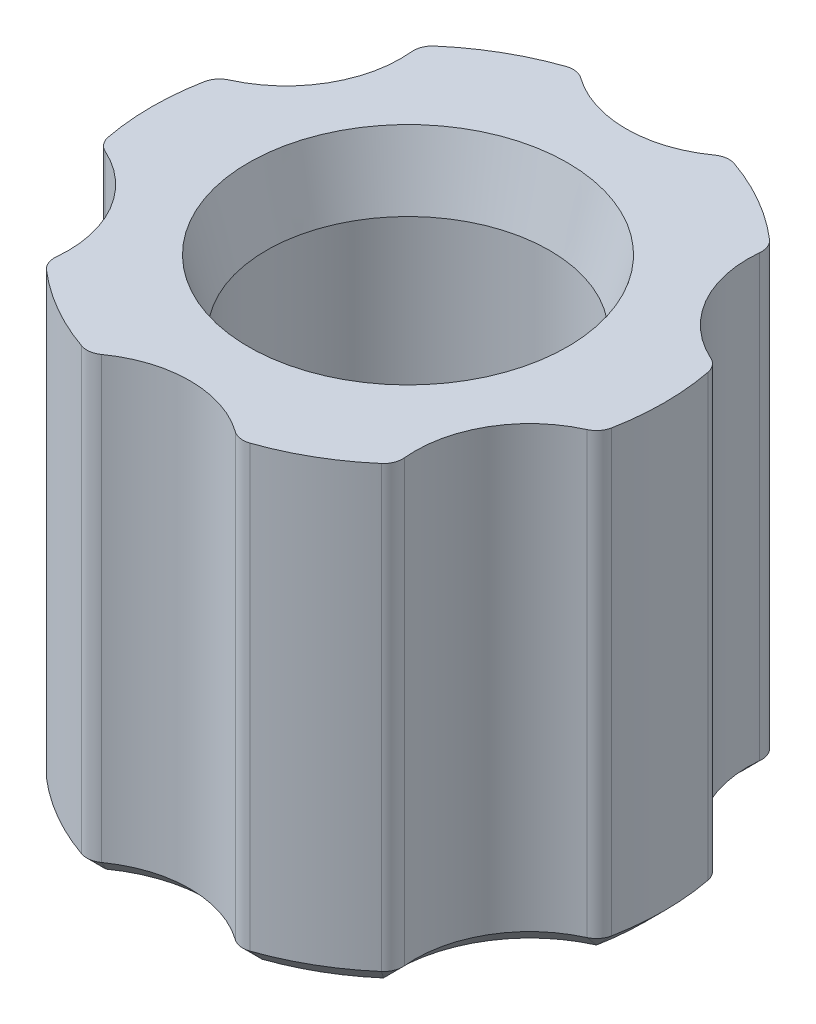
from build123d import *

# Parameters (mm, degrees)
CHAMFER1_SIZE      = 1.75
CHAMFER1_SIZE2     = 0.468911087
SKETCH2_R          = 3
CUT_EXTRUDE1_DEPTH = 16.289865925
CIRPATTERN1_COUNT  = 6
FILLET1_R          = 0.5
CHAMFER2_SIZE      = 0.5


with BuildPart() as part:
    # Sketch1 → Revolve1 (revolve)
    with BuildSketch(Plane(origin=(0, 0, 0), x_dir=(0, 0, -1), z_dir=(1, 0, 0)), mode=Mode.PRIVATE) as revolve1_sk:
        Polygon((0, 0), (-6.7, 0), (-6.7, 12), (-3.7, 12), (-3.7, 4.268512728), (-4.1, 2), (0, 2), align=None)
    revolve(revolve1_sk.sketch.rotate(Axis((0, 0, 0), (0, 1, 0)), 180), axis=Axis((0, 0, 0), (0, 1, 0)))

    # Chamfer1
    chamfer1_edges = [part.edges().sort_by_distance(p)[0] for p in [
        (0, 12, 3.7),
    ]]
    chamfer1_side = [part.faces().sort_by_distance(p)[0] for p in [
        (0, 8.134256364, 3.7),
    ]]
    chamfer(chamfer1_edges, length=CHAMFER1_SIZE, length2=CHAMFER1_SIZE2, reference=chamfer1_side[0])

    # Sketch2 → Cut-Extrude1 (cut, through all)
    with BuildSketch(Plane(origin=(0, 0, 0), x_dir=(1, 0, 0), z_dir=(0, 1, 0))):
        with Locations((0, 8.7)):
            Circle(SKETCH2_R)
    cut_extrude1 = extrude(amount=CUT_EXTRUDE1_DEPTH, mode=Mode.SUBTRACT)

    # CirPattern1: Cut-Extrude1 ×6 about axis
    cirpattern1_axis = Axis((0, 0, 0), (0, 1, 0))
    for i in range(1, CIRPATTERN1_COUNT):
        add(cut_extrude1.rotate(cirpattern1_axis, i * 360 / CIRPATTERN1_COUNT), mode=Mode.SUBTRACT)

    # Fillet1
    fillet1_edges = [part.edges().sort_by_distance(p)[0] for p in [
        (1.941133962, 6, -6.412643678),
        (-1.941133962, 6, -6.412643678),
        (6.524079312, 6, -1.525250516),
        (4.58294535, 6, -4.887393162),
        (4.58294535, 6, 4.887393162),
        (6.524079312, 6, 1.525250516),
        (-1.941133962, 6, 6.412643678),
        (1.941133962, 6, 6.412643678),
        (-6.524079312, 6, 1.525250516),
        (-4.58294535, 6, 4.887393162),
        (-4.58294535, 6, -4.887393162),
        (-6.524079312, 6, -1.525250516),
    ]]
    fillet(fillet1_edges, radius=FILLET1_R)

    # Chamfer2
    chamfer2_edges = [part.edges().sort_by_distance(p)[0] for p in [
        (4.936344802, 0, -2.85),
        (6.7, 0, 0),
        (4.936344802, 0, 2.85),
        (3.35, 0, 5.802370205),
        (0, 0, 5.7),
        (-3.35, 0, 5.802370205),
        (-4.936344802, 0, 2.85),
        (-6.7, 0, 0),
        (-4.936344802, 0, -2.85),
        (-3.35, 0, -5.802370205),
        (0, 0, -5.7),
        (3.35, 0, -5.802370205),
        (-4.515588694, 0, -4.878854752),
        (4.515588694, 0, -4.878854752),
        (1.96741781, 0, -6.350041898),
        (-1.96741781, 0, -6.350041898),
        (-6.483006504, 0, -1.471187146),
        (-6.483006504, 0, 1.471187146),
        (-4.515588694, 0, 4.878854752),
        (-1.96741781, 0, 6.350041898),
        (1.96741781, 0, 6.350041898),
        (4.515588694, 0, 4.878854752),
        (6.483006504, 0, 1.471187146),
        (6.483006504, 0, -1.471187146),
    ]]
    chamfer(chamfer2_edges, length=CHAMFER2_SIZE - 0.0001)  # a hair under: the kernel refuses the full size


solid = part.part
